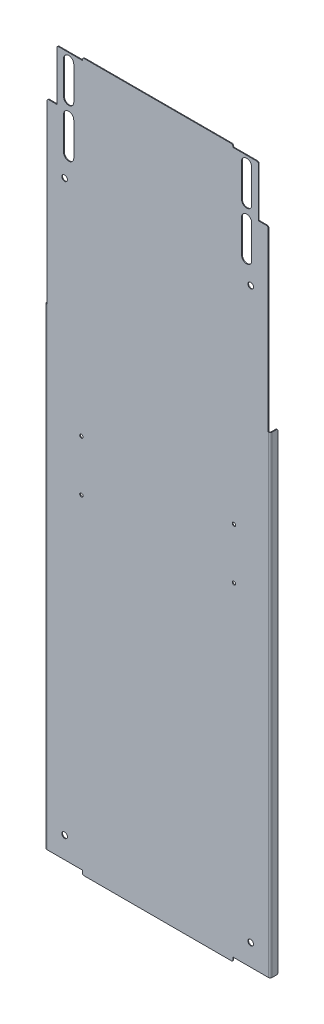
from build123d import *

# Parameters (mm, degrees)
SKETCH_1_W                          = 440
SKETCH_1_H                          = 1392
EXTRUDE_1_DEPTH                     = 1.5
SKETCH_5_W                          = 22
SKETCH_5_H                          = 105
CUT_EXTRUDE_4_DEPTH                 = 5
SKETCH_2_R                          = 3.3
CUT_EXTRUDE_1813_DEPTH              = 10
CUT_EXTRUDE_2195_DEPTH              = 10
SKETCH_8_R                          = 5.5
CUT_EXTRUDE_3659_DEPTH              = 1.5
CUT_EXTRUDE_4343_DEPTH              = 730.944004702
CUT_EXTRUDE_4343_DEPTH_BACK         = 730.944004702
SKETCH_21_W                         = 72
SKETCH_21_H                         = 8
SKETCH_21_W_2                       = 50
SKETCH_21_H_2                       = 5
SM_EDGE_FLANGE_2_STRIP_W            = 10
SM_EDGE_FLANGE_2_STRIP_H            = 1.5
SM_EDGE_FLANGE_2_STRIP_CUT_DEPTH    = 929
SM_EDGE_FLANGE_2_RELIEF_W           = 10.75
SM_EDGE_FLANGE_2_RELIEF_H           = 0.75
SM_EDGE_FLANGE_2_RELIEF_CUT_DEPTH   = 1.5
SM_EDGE_FLANGE_2_STRIP_2_W          = 10
SM_EDGE_FLANGE_2_STRIP_2_H          = 1.5
SM_EDGE_FLANGE_2_STRIP_CUT_2_DEPTH  = 929
SM_EDGE_FLANGE_2_RELIEF_2_W         = 10.75
SM_EDGE_FLANGE_2_RELIEF_2_H         = 0.75
SM_EDGE_FLANGE_2_RELIEF_CUT_2_DEPTH = 1.5
SM_EDGE_FLANGE_2_DEPTH              = 929
SM_EDGE_FLANGE_2_BEND_DEPTH         = 929
SKETCH_32_W                         = 2.75
SKETCH_32_H                         = 349.25
CUT_EXTRUDE_7725_DEPTH              = 1.5
FILLET_5_R                          = 3


# Sheet-metal steps are written as plain solids
with BuildPart() as part:
    # Эскиз1 → Бобышка-Вытянуть1 (new body)
    with BuildSketch(Plane.XY):
        Rectangle(SKETCH_1_W, SKETCH_1_H)
    extrude(amount=EXTRUDE_1_DEPTH)

    # Эскиз5 → Вырез-Вытянуть4 (cut)
    with BuildSketch(Plane.XY.offset(1.5)):
        with Locations((-209, 643.5)):
            Rectangle(SKETCH_5_W, SKETCH_5_H)
        with Locations((209, 643.5)):
            Rectangle(SKETCH_5_W, SKETCH_5_H)
    extrude(amount=-CUT_EXTRUDE_4_DEPTH, mode=Mode.SUBTRACT)

    # Эскиз2 → Cut-Extrude 1813 (cut)
    with BuildSketch(Plane.XY.offset(1.5)):
        with Locations((-150, 50)):
            Circle(SKETCH_2_R)
        with Locations(Location((-150, -50, 0), (0, 0, 180))):
            Circle(SKETCH_2_R)
        with Locations((150, -50)):
            Circle(SKETCH_2_R)
        with Locations(Location((150, 50, 0), (0, 0, 180))):
            Circle(SKETCH_2_R)
    extrude(amount=-CUT_EXTRUDE_1813_DEPTH, mode=Mode.SUBTRACT)

    # Sketch 3 → Cut-Extrude 2195 (cut)
    with BuildSketch(Plane.XY.offset(1.5)):
        with BuildLine():
            Line((-185, 611), (-185, 676))
            ThreePointArc((-185, 676), (-175, 686), (-165, 676))
            Line((-165, 676), (-165, 611))
            ThreePointArc((-165, 611), (-175, 601), (-185, 611))
        make_face()
        with BuildLine():
            Line((-185, 516), (-185, 581))
            ThreePointArc((-185, 581), (-175, 591), (-165, 581))
            Line((-165, 581), (-165, 516))
            ThreePointArc((-165, 516), (-175, 506), (-185, 516))
        make_face()
        with BuildLine():
            Line((165, 516), (165, 581))
            ThreePointArc((165, 581), (175, 591), (185, 581))
            Line((185, 581), (185, 516))
            ThreePointArc((185, 516), (175, 506), (165, 516))
        make_face()
        with BuildLine():
            Line((165, 611), (165, 676))
            ThreePointArc((165, 676), (175, 686), (185, 676))
            Line((185, 676), (185, 611))
            ThreePointArc((185, 611), (175, 601), (165, 611))
        make_face()
    extrude(amount=-CUT_EXTRUDE_2195_DEPTH, mode=Mode.SUBTRACT)

    # Эскиз8 → Cut-Extrude 3659 (cut)
    with BuildSketch(Plane.XY.offset(1.5)):
        with Locations((183, -646)):
            Circle(SKETCH_8_R)
        with Locations((-183, -646)):
            Circle(SKETCH_8_R)
        with Locations((183, 473)):
            Circle(SKETCH_8_R)
        with Locations((-183, 473)):
            Circle(SKETCH_8_R)
    extrude(amount=-CUT_EXTRUDE_3659_DEPTH, mode=Mode.SUBTRACT)

    # Эскиз21 → Cut-Extrude 4343 (cut, two sides: drawn at the far end of the back side and taken through both)
    with BuildSketch(Plane.XY.offset(1.5).offset(-CUT_EXTRUDE_4343_DEPTH_BACK)):
        with Locations((-184, -692)):
            Rectangle(SKETCH_21_W, SKETCH_21_H)
        with Locations((-173, 693.5)):
            Rectangle(SKETCH_21_W_2, SKETCH_21_H_2)
        with Locations((184, -692)):
            Rectangle(SKETCH_21_W, SKETCH_21_H)
        with Locations((173, 693.5)):
            Rectangle(SKETCH_21_W_2, SKETCH_21_H_2)
    extrude(amount=CUT_EXTRUDE_4343_DEPTH + CUT_EXTRUDE_4343_DEPTH_BACK, mode=Mode.SUBTRACT)

    # Ребро-кромка2: sheet metal written as solids
    # Ребро-кромка2 strip (on a plane across the edge) → Ребро-кромка2 strip cut (cut)
    with BuildSketch(Plane(origin=(-220, -688, 0), x_dir=(1, 0, 0), z_dir=(0, 1, 0))):
        with Locations((-3, -0.75)):
            Rectangle(SM_EDGE_FLANGE_2_STRIP_W, SM_EDGE_FLANGE_2_STRIP_H)
    extrude(amount=SM_EDGE_FLANGE_2_STRIP_CUT_DEPTH, mode=Mode.SUBTRACT)

    # Ребро-кромка2 relief (on the sheet) → Ребро-кромка2 relief cut (cut)
    with BuildSketch(Plane(origin=(-218, -688, 0), x_dir=(1, 0, 0), z_dir=(0, 0, -1))):
        with Locations((-4.625, -929.375)):
            Rectangle(SM_EDGE_FLANGE_2_RELIEF_W, SM_EDGE_FLANGE_2_RELIEF_H)
    extrude(amount=-SM_EDGE_FLANGE_2_RELIEF_CUT_DEPTH, mode=Mode.SUBTRACT)

    # Ребро-кромка2 strip 2 (on a plane across the edge) → Ребро-кромка2 strip cut 2 (cut)
    with BuildSketch(Plane(origin=(220, 241, 0), x_dir=(-1, 0, 0), z_dir=(0, -1, 0))):
        with Locations((-3, -0.75)):
            Rectangle(SM_EDGE_FLANGE_2_STRIP_2_W, SM_EDGE_FLANGE_2_STRIP_2_H)
    extrude(amount=SM_EDGE_FLANGE_2_STRIP_CUT_2_DEPTH, mode=Mode.SUBTRACT)

    # Ребро-кромка2 relief 2 (on the sheet) → Ребро-кромка2 relief cut 2 (cut)
    with BuildSketch(Plane(origin=(218, 241, 0), x_dir=(-1, 0, 0), z_dir=(0, 0, -1))):
        with Locations((-4.625, 0.375)):
            Rectangle(SM_EDGE_FLANGE_2_RELIEF_2_W, SM_EDGE_FLANGE_2_RELIEF_2_H)
    extrude(amount=-SM_EDGE_FLANGE_2_RELIEF_CUT_2_DEPTH, mode=Mode.SUBTRACT)

    # Ребро-кромка2 section (on a plane across the edge) → Ребро-кромка2 (add)
    with BuildSketch(Plane(origin=(-220, -688, 0), x_dir=(1, 0, 0), z_dir=(0, 1, 0))):
        with BuildLine():
            Line((-1.5, 2), (-1.5, 13.5))
            Line((-1.5, 13.5), (0, 13.5))
            Line((0, 13.5), (0, 2))
            ThreePointArc((0, 2), (0.585786438, 0.585786438), (2, 0))
            Line((2, 0), (2, -1.5))
            ThreePointArc((2, -1.5), (-0.474873734, -0.474873734), (-1.5, 2))
        make_face()
    extrude(amount=SM_EDGE_FLANGE_2_DEPTH)

    # Ребро-кромка2 section 2 (on a plane across the edge) → Ребро-кромка2 bend (add)
    with BuildSketch(Plane(origin=(220, 241, 0), x_dir=(-1, 0, 0), z_dir=(0, -1, 0))):
        with BuildLine():
            Line((-1.5, 2), (-1.5, 13.5))
            Line((-1.5, 13.5), (0, 13.5))
            Line((0, 13.5), (0, 2))
            ThreePointArc((0, 2), (0.585786438, 0.585786438), (2, 0))
            Line((2, 0), (2, -1.5))
            ThreePointArc((2, -1.5), (-0.474873734, -0.474873734), (-1.5, 2))
        make_face()
    extrude(amount=SM_EDGE_FLANGE_2_BEND_DEPTH)

    # Эскиз32 → Cut-Extrude 7725 (cut)
    with BuildSketch(Plane.XY.offset(1.5)):
        with Locations((-218.625, 416.375)):
            Rectangle(SKETCH_32_W, SKETCH_32_H)
        with Locations((218.625, 416.375)):
            Rectangle(SKETCH_32_W, SKETCH_32_H)
    extrude(amount=-CUT_EXTRUDE_7725_DEPTH, mode=Mode.SUBTRACT)

    # Скругление5
    fillet_5_edges = [part.edges().sort_by_distance(p)[0] for p in [
        (-220.75, -688, -13.5),
        (-220.75, 241, -13.5),
        (220.75, 241, -13.5),
        (220.75, -688, -13.5),
        (-217.25, 591, 0.75),
        (217.25, 591, 0.75),
        (-148, 696, 0.75),
        (148, 696, 0.75),
        (198, 691, 0.75),
        (148, -696, 0.75),
        (-148, -696, 0.75),
        (-198, 691, 0.75),
    ]]
    fillet(fillet_5_edges, radius=FILLET_5_R)


solid = part.part
